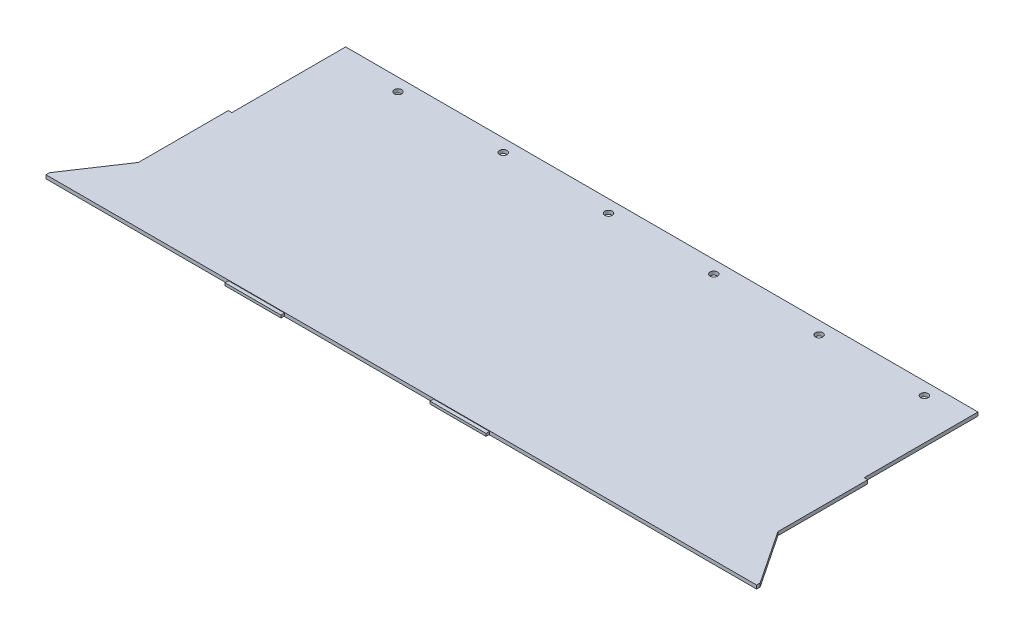
from build123d import *

# Parameters (mm, degrees)
SKETCH1_W           = 570.861
SKETCH1_H           = 3.175
BOSS_EXTRUDE1_DEPTH = 232.6
SKETCH7_R           = 3.302
CUT_EXTRUDE4_DEPTH  = 369.216527271
SKETCH6_W           = 50
SKETCH6_H           = 2.286
BOSS_EXTRUDE2_DEPTH = 3.175
LPATTERN1_COUNT     = 6
LPATTERN1_PITCH     = 93.98
SKETCH2_W           = 3.175
SKETCH2_H           = 101.6
CUT_EXTRUDE5_DEPTH  = 371.230335845
BOSS_EXTRUDE3_DEPTH = 3.175


with BuildPart() as part:
    # Sketch1 → Boss-Extrude1 (new body)
    with BuildSketch(Plane.XY):
        Rectangle(SKETCH1_W, SKETCH1_H)
    extrude(amount=BOSS_EXTRUDE1_DEPTH)

    # Sketch7 → Cut-Extrude4 (cut, through all)
    with BuildSketch(Plane(origin=(0, -1.5875, 0), x_dir=(-1, 0, 0), z_dir=(0, -1, 0))):
        with Locations((-245.6805, -11.29165)):
            Circle(SKETCH7_R)
    cut_extrude4 = extrude(amount=-CUT_EXTRUDE4_DEPTH, mode=Mode.SUBTRACT)

    # Sketch6 → Boss-Extrude2 (add)
    with BuildSketch(Plane.XY.offset(232.6)):
        with Locations((53.761993, 0)):
            Rectangle(SKETCH6_W, SKETCH6_H)
        with Locations((-129.238007, 0)):
            Rectangle(SKETCH6_W, SKETCH6_H)
    extrude(amount=BOSS_EXTRUDE2_DEPTH)

    # LPattern1: Cut-Extrude4 ×6
    with Locations(*[(-i * LPATTERN1_PITCH, 0, 0) for i in range(1, LPATTERN1_COUNT)]):
        add(cut_extrude4, mode=Mode.SUBTRACT)

    # Sketch2 → Cut-Extrude5 (cut, through all)
    with BuildSketch(Plane(origin=(0, 1.5875, 0), x_dir=(1, 0, 0), z_dir=(0, 1, 0))):
        with Locations((283.843, -50.8)):
            Rectangle(SKETCH2_W, SKETCH2_H)
        with Locations((-283.843, -50.8)):
            Rectangle(SKETCH2_W, SKETCH2_H)
    extrude(amount=-CUT_EXTRUDE5_DEPTH, mode=Mode.SUBTRACT)

    # Sketch12 → Boss-Extrude3 (add)
    with BuildSketch(Plane(origin=(0, 1.5875, 0), x_dir=(1, 0, 0), z_dir=(0, 1, 0))):
        Polygon((-317.1805, -232.6), (-285.4305, -232.6), (-285.4305, -181.8), (-317.1805, -229.425), align=None)
    boss_extrude3 = extrude(amount=-BOSS_EXTRUDE3_DEPTH)

    # Mirror1: Boss-Extrude3 across plane
    add(boss_extrude3.mirror(Plane(origin=(0, 0, 0), x_dir=(0, 0, 1), z_dir=(1, 0, 0))))


solid = part.part
